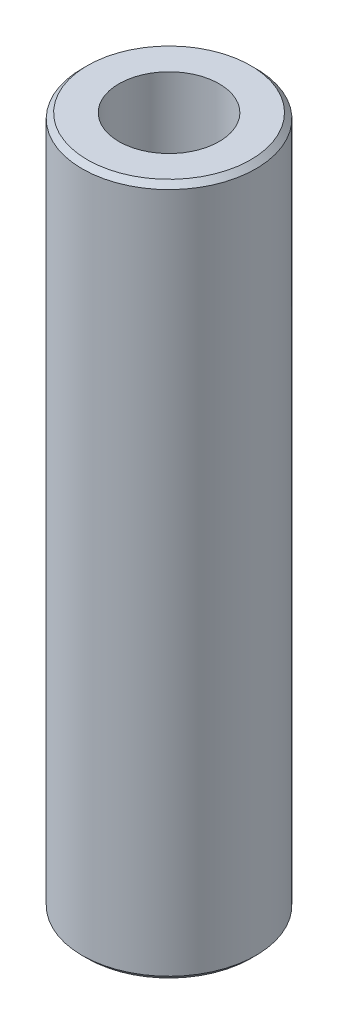
from build123d import *

# Parameters (mm, degrees)
SKETCH1_R           = 35
BOSS_EXTRUDE1_DEPTH = 278.674665532
SKETCH2_R           = 20.189399619
CUT_EXTRUDE1_DEPTH  = 284.036339027
CHAMFER1_SIZE       = 2.101512386


with BuildPart() as part:
    # Sketch1 → Boss-Extrude1 (new body)
    with BuildSketch(Plane(origin=(0, 0, 0), x_dir=(1, 0, 0), z_dir=(0, 1, 0))):
        Circle(SKETCH1_R)
    extrude(amount=BOSS_EXTRUDE1_DEPTH)

    # Sketch2 → Cut-Extrude1 (cut, through all)
    with BuildSketch(Plane(origin=(0, 0, 0), x_dir=(1, 0, 0), z_dir=(0, 1, 0))):
        Circle(SKETCH2_R)
    extrude(amount=CUT_EXTRUDE1_DEPTH, mode=Mode.SUBTRACT)

    # Chamfer1
    chamfer1_edges = [part.edges().sort_by_distance(p)[0] for p in [
        (-35, 278.674665532, 0),
        (-35, 0, 0),
    ]]
    chamfer(chamfer1_edges, length=CHAMFER1_SIZE)


solid = part.part
